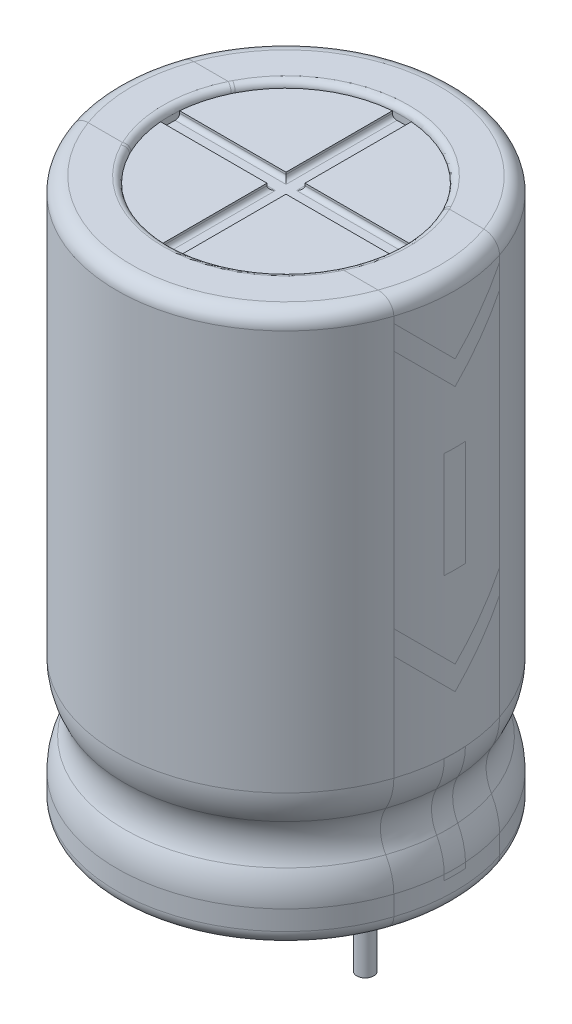
from build123d import *

# Parameters (mm, degrees)
FILLET_1_R          = 3
SKETCH_2_R          = 5.5
CUT_EXTRUDE_1_DEPTH = 0.3
CUT_EXTRUDE_2_DEPTH = 0.3
FILLET_2_R          = 0.2
FILLET_3_R          = 0.7
FILLET_4_R          = 0.7
CUT_EXTRUDE_START   = -0.3
SKETCH_4_R          = 5.5
CUT_EXTRUDE_3_DEPTH = 0.3
SKETCH_5_R          = 0.4
EXTRUDE_1_DEPTH     = 5
FILLET_5_R          = 0.3
FILLET_6_R          = 0.3


with BuildPart() as part:
    # Эскиз1 → Повернуть1 (revolve)
    with BuildSketch(Plane.XY, mode=Mode.PRIVATE) as revolve_1_sk:
        with BuildLine():
            Line((0, 0), (-8, 0))
            Line((-8, 0), (-8, 2.571714314))
            ThreePointArc((-8, 2.571714314), (-7.4, 4), (-8, 5.428285686))
            Line((-8, 5.428285686), (-8, 26))
            Line((-8, 26), (0, 26))
            Line((0, 26), (0, 0))
        make_face()
    revolve(revolve_1_sk.sketch.rotate(Axis((0, 30.497916687, 0), (0, -1, 0)), 270), axis=Axis((0, 30.497916687, 0), (0, -1, 0)))

    # Скругление1
    fillet_1_edges = [part.edges().sort_by_distance(p)[0] for p in [
        (0, 2.571714314, -8),
        (0, 5.428285686, -8),
    ]]
    fillet(fillet_1_edges, radius=FILLET_1_R)

    # Эскиз2 → Вырез-Вытянуть1 (cut)
    with BuildSketch(Plane(origin=(0, 26, 0), x_dir=(1, 0, 0), z_dir=(0, 1, 0))):
        with Locations(Location((0, 0, 0), (0, 0, 270))):
            Circle(SKETCH_2_R)
    extrude(amount=-CUT_EXTRUDE_1_DEPTH, mode=Mode.SUBTRACT)

    # Эскиз3 → Вырез-Вытянуть2 (cut)
    with BuildSketch(Plane(origin=(0, 25.7, 0), x_dir=(1, 0, 0), z_dir=(0, 1, 0))):
        with BuildLine():
            Line((-0.45, 5.481559997), (-0.45, 0.45))
            Line((-0.45, 0.45), (-5.481559997, 0.45))
            ThreePointArc((-5.481559997, 0.45), (-5.5, 0), (-5.481559997, -0.45))
            Line((-5.481559997, -0.45), (-0.45, -0.45))
            Line((-0.45, -0.45), (-0.45, -5.481559997))
            ThreePointArc((-0.45, -5.481559997), (0, -5.5), (0.45, -5.481559997))
            Line((0.45, -5.481559997), (0.45, -0.45))
            Line((0.45, -0.45), (5.481559997, -0.45))
            ThreePointArc((5.481559997, -0.45), (5.5, 0), (5.481559997, 0.45))
            Line((5.481559997, 0.45), (0.45, 0.45))
            Line((0.45, 0.45), (0.45, 5.481559997))
            ThreePointArc((0.45, 5.481559997), (0, 5.5), (-0.45, 5.481559997))
        make_face()
    extrude(amount=-CUT_EXTRUDE_2_DEPTH, mode=Mode.SUBTRACT)

    # Скругление2
    fillet_2_edges = [part.edges().sort_by_distance(p)[0] for p in [
        (0.45, 25.4, -2.965779998),
        (2.965779998, 25.4, -0.45),
        (2.965779998, 25.4, 0.45),
        (0.45, 25.4, 2.965779998),
        (-0.45, 25.4, 2.965779998),
        (-2.965779998, 25.4, 0.45),
        (-2.965779998, 25.4, -0.45),
        (-0.45, 25.4, -2.965779998),
    ]]
    fillet(fillet_2_edges, radius=FILLET_2_R)

    # Скругление3
    fillet_3_edges = [part.edges().sort_by_distance(p)[0] for p in [
        (0, 26, -8),
    ]]
    fillet(fillet_3_edges, radius=FILLET_3_R)

    # Скругление4
    fillet_4_edges = [part.edges().sort_by_distance(p)[0] for p in [
        (0, 0, -8),
    ]]
    fillet(fillet_4_edges, radius=FILLET_4_R)

    # Эскиз4 → Вырез-Вытянуть3 (cut)
    with BuildSketch(Plane.XZ.offset(CUT_EXTRUDE_START)):
        with Locations(Location((0, 0, 0), (0, 0, 90))):
            Circle(SKETCH_4_R)
    extrude(amount=CUT_EXTRUDE_3_DEPTH, mode=Mode.SUBTRACT)

    # Эскиз5 → Бобышка-Вытянуть1 (add)
    with BuildSketch(Plane.XZ.offset(-0.3)):
        with Locations(Location((-3.75, 0, 0), (0, 0, 270))):
            Circle(SKETCH_5_R)
        with Locations(Location((3.75, 0, 0), (0, 0, 90))):
            Circle(SKETCH_5_R)
    extrude(amount=EXTRUDE_1_DEPTH)

    # Скругление5
    fillet_5_edges = [part.edges().sort_by_distance(p)[0] for p in [
        (0, 26, -5.5),
    ]]
    fillet(fillet_5_edges, radius=FILLET_5_R - 0.0001)  # a hair under: the kernel refuses the full size

    # Скругление6
    fillet_6_edges = [part.edges().sort_by_distance(p)[0] for p in [
        (0, 0, -5.5),
    ]]
    fillet(fillet_6_edges, radius=FILLET_6_R - 0.0001)  # a hair under: the kernel refuses the full size


solid = part.part
